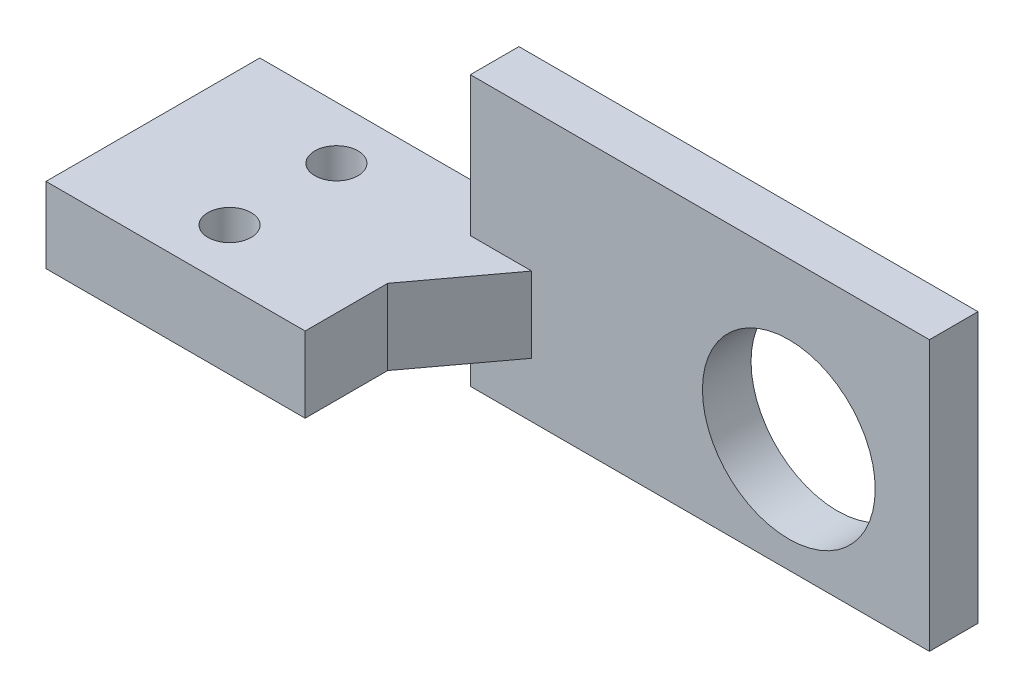
from build123d import *

# Parameters (mm, degrees)
SKETCH1_R                 = 11
SKETCH1_R_2               = 8
BOSS_EXTRUDE1_DEPTH       = 4.8
SKETCH2_W                 = 44.821432693
SKETCH2_H                 = 40.097165435
SKETCH2_R                 = 11
BOSS_EXTRUDE2_DEPTH       = 8.2
SKETCH3_W                 = 24
SKETCH3_H                 = 15
SKETCH3_R                 = 8
BOSS_EXTRUDE3_DEPTH       = 5
BOSS_EXTRUDE4_OUTLINE_W   = 48.178567307
BOSS_EXTRUDE4_OUTLINE_H   = 40.5
BOSS_EXTRUDE4_OUTLINE_R   = 1.6
BOSS_EXTRUDE4_OUTLINE_R_2 = 6.35
BOSS_EXTRUDE4_OUTLINE_R_3 = 2.1
BOSS_EXTRUDE4_DEPTH       = 5
BOSS_EXTRUDE5_DEPTH       = 5
SKETCH6_W                 = 48.178567307
SKETCH6_H                 = 17.568704936
BOSS_EXTRUDE6_DEPTH       = 5
SKETCH8_R                 = 2
CUT_EXTRUDE1_DEPTH        = 127.437257167
CUT_EXTRUDE2_START        = -23.95
CUT_EXTRUDE2_OUTLINE_W    = 64.98154514
CUT_EXTRUDE2_OUTLINE_H    = 102.7
CUT_EXTRUDE2_OUTLINE_R    = 11
CUT_EXTRUDE2_DEPTH        = 23.95
CUT_EXTRUDE2_START_2      = -45.3
CUT_EXTRUDE2_2_DEPTH      = 21.35
SKETCH13_W                = 48.029963693
SKETCH13_H                = 72.7
CUT_EXTRUDE5_DEPTH        = 100
SKETCH14_W                = 52.01845486
SKETCH14_H                = 5
CUT_EXTRUDE6_DEPTH        = 100
SKETCH15_W                = 24
SKETCH15_H                = 10
BOSS_EXTRUDE7_DEPTH       = 10
SKETCH16_R                = 2
CUT_EXTRUDE7_DEPTH        = 30
SKETCH17_W                = 28.01845486
SKETCH17_H                = 5.3
CUT_EXTRUDE11_DEPTH       = 100
SKETCH18_W                = 24
SKETCH18_H                = 4.59
CUT_EXTRUDE12_DEPTH       = 43.450839953
SKETCH19_W                = 4.5
SKETCH19_H                = 7
BOSS_EXTRUDE8_DEPTH       = 24
SKETCH20_W                = 24
SKETCH20_H                = 7
BOSS_EXTRUDE9_DEPTH       = 15.3
SKETCH21_R                = 2
CUT_EXTRUDE13_DEPTH       = 39
SKETCH22_W                = 24
SKETCH22_H                = 5.41
CUT_EXTRUDE14_DEPTH       = 39
BOSS_EXTRUDE11_START      = -7
BOSS_EXTRUDE11_DEPTH      = 7
SKETCH26_W                = 4.5
SKETCH26_H                = 25
BOSS_EXTRUDE12_DEPTH      = 14.5
BOSS_EXTRUDE13_START      = -4.5
SKETCH27_R                = 8
BOSS_EXTRUDE13_DEPTH      = 4.5
SKETCH28_R                = 8
CUT_EXTRUDE15_DEPTH       = 4.5


# Read off the part's stored shape, not the designer's step: Boss-Extrude4, Cut-Extrude2
with BuildPart() as part:
    # Sketch1 → Boss-Extrude1 (new body)
    # profile 1 of 2: a face of its own
    with BuildSketch(Plane.XY):
        Polygon((0, 0), (93, 0), (93, 102.7), (0, 102.7), (0, 30), (-24, 30), (-24, 15), (0, 15), align=None)
        with Locations((15, 10.5)):
            Circle(SKETCH1_R, mode=Mode.SUBTRACT)
        with Locations((70, 72)):
            Circle(SKETCH1_R, mode=Mode.SUBTRACT)
    # profile 2 of 2: a face of its own
    with BuildSketch(Plane.XY):
        with BuildLine():
            ThreePointArc((26, 10.5), (8.48332569, 19.36188219), (11.721280738, 0))
            Line((11.721280738, 0), (18.278719262, 0))
            ThreePointArc((18.278719262, 0), (23.86188219, 3.98332569), (26, 10.5))
        make_face()
        with Locations((15, 10.5)):
            Circle(SKETCH1_R_2, mode=Mode.SUBTRACT)
    extrude(amount=BOSS_EXTRUDE1_DEPTH)

    # Sketch2 → Boss-Extrude2 (add)
    with BuildSketch(Plane.XY.offset(4.8)):
        with Locations((70.589283654, 72.714594712)):
            Rectangle(SKETCH2_W, SKETCH2_H)
        with Locations((70, 72)):
            Circle(SKETCH2_R, mode=Mode.SUBTRACT)
    extrude(amount=BOSS_EXTRUDE2_DEPTH)

    # Sketch3 → Boss-Extrude3 (add)
    # profile 1 of 2: a face of its own
    with BuildSketch(Plane.XY.offset(4.8)):
        with Locations((-12, 22.5)):
            Rectangle(SKETCH3_W, SKETCH3_H)
    # profile 2 of 2: a face of its own
    with BuildSketch(Plane.XY.offset(4.8)):
        Polygon((0, 30), (0, 15), (0, 0), (93, 0), (93, 52.666011994), (48.178567307, 52.666011994), (0, 52.666011994), align=None)
        with Locations((15, 10.5)):
            Circle(SKETCH3_R, mode=Mode.SUBTRACT)
    extrude(amount=BOSS_EXTRUDE3_DEPTH)

    # Boss-Extrude4 outline → Boss-Extrude4 (add)
    # profile 1 of 2: a face of its own
    with BuildSketch(Plane.XZ.offset(-75.23471693)):
        with Locations((24.089283654, 25.05)):
            Rectangle(BOSS_EXTRUDE4_OUTLINE_W, BOSS_EXTRUDE4_OUTLINE_H)
        with Locations((22.860422048, 23.3)):
            Circle(BOSS_EXTRUDE4_OUTLINE_R, mode=Mode.SUBTRACT)
        with Locations((38.360422048, 30.3)):
            Circle(BOSS_EXTRUDE4_OUTLINE_R_2, mode=Mode.SUBTRACT)
        with Locations((30.610422048, 36.723393759)):
            Circle(BOSS_EXTRUDE4_OUTLINE_R, mode=Mode.SUBTRACT)
        with Locations((46.110422048, 36.723393759)):
            Circle(BOSS_EXTRUDE4_OUTLINE_R, mode=Mode.SUBTRACT)
    # profile 2 of 2: a face of its own
    with BuildSketch(Plane.XZ.offset(-75.23471693)):
        with Locations((51.783815806, 31.05)):
            Circle(BOSS_EXTRUDE4_OUTLINE_R_3)
    extrude(amount=BOSS_EXTRUDE4_DEPTH)

    # Sketch5 → Boss-Extrude5 (add)
    with BuildSketch(Plane(origin=(48.178567307, 0, 0), x_dir=(0, 0, -1), z_dir=(1, 0, 0))):
        Polygon((-45.3, 75.23471693), (-13, 92.763177429), (-4.8, 92.763177429), (-4.8, 70.23471693), (-45.3, 70.23471693), align=None)
    extrude(amount=-BOSS_EXTRUDE5_DEPTH)

    # Sketch6 → Boss-Extrude6 (add)
    with BuildSketch(Plane.XY.offset(4.8)):
        with Locations((24.089283654, 61.450364462)):
            Rectangle(SKETCH6_W, SKETCH6_H)
    extrude(amount=BOSS_EXTRUDE6_DEPTH)

    # Sketch8 → Cut-Extrude1 (cut, through all)
    with BuildSketch(Plane(origin=(0, 30, 0), x_dir=(1, 0, 0), z_dir=(0, 1, 0))):
        with Locations(Location((-12, -4.9, 0), (0, 0, 180))):
            Circle(SKETCH8_R)
    extrude(amount=-CUT_EXTRUDE1_DEPTH, mode=Mode.SUBTRACT)

    # Cut-Extrude2 outline → Cut-Extrude2 (cut)
    with BuildSketch(Plane(origin=(0, 0, 0), x_dir=(-1, 0, 0), z_dir=(0, 0, -1)).offset(CUT_EXTRUDE2_START)):
        with Locations((-60.50922743, 51.35)):
            Rectangle(CUT_EXTRUDE2_OUTLINE_W, CUT_EXTRUDE2_OUTLINE_H)
        with Locations((-70, 72)):
            Circle(CUT_EXTRUDE2_OUTLINE_R, mode=Mode.SUBTRACT)
    extrude(amount=CUT_EXTRUDE2_DEPTH, mode=Mode.SUBTRACT)

    # Cut-Extrude2 2 outline → Cut-Extrude2 2 (cut)
    with BuildSketch(Plane(origin=(0, 0, 0), x_dir=(-1, 0, 0), z_dir=(0, 0, -1)).offset(CUT_EXTRUDE2_START_2)):
        Polygon((-28.01845486, 70.23471693), (-28.01845486, 75.23471693), (-43.178567307, 75.23471693), (-43.178567307, 92.763177429), (-48.178567307, 92.763177429), (-48.178567307, 70.23471693), align=None)
    extrude(amount=CUT_EXTRUDE2_2_DEPTH, mode=Mode.SUBTRACT)

    # Sketch13 → Cut-Extrude5 (cut)
    with BuildSketch(Plane.ZY):
        with Locations((24.014981847, 66.35)):
            Rectangle(SKETCH13_W, SKETCH13_H)
    extrude(amount=-CUT_EXTRUDE5_DEPTH, mode=Mode.SUBTRACT)

    # Sketch14 → Cut-Extrude6 (cut)
    with BuildSketch(Plane.XY.offset(9.8)):
        with Locations((2.00922743, 27.5)):
            Rectangle(SKETCH14_W, SKETCH14_H)
    extrude(amount=-CUT_EXTRUDE6_DEPTH, mode=Mode.SUBTRACT)

    # Sketch15 → Boss-Extrude7 (add)
    with BuildSketch(Plane.XY.offset(9.8)):
        with Locations((-12, 20)):
            Rectangle(SKETCH15_W, SKETCH15_H)
    extrude(amount=BOSS_EXTRUDE7_DEPTH)

    # Sketch16 → Cut-Extrude7 (cut)
    with BuildSketch(Plane(origin=(0, 25, 0), x_dir=(1, 0, 0), z_dir=(0, 1, 0))):
        with Locations(Location((-12, -14.8, 0), (0, 0, 270))):
            Circle(SKETCH16_R)
    extrude(amount=-CUT_EXTRUDE7_DEPTH, mode=Mode.SUBTRACT)

    # Sketch17 → Cut-Extrude11 (cut)
    with BuildSketch(Plane(origin=(0, 25, 0), x_dir=(1, 0, 0), z_dir=(0, 1, 0))):
        with Locations((14.00922743, -7.15)):
            Rectangle(SKETCH17_W, SKETCH17_H)
    extrude(amount=-CUT_EXTRUDE11_DEPTH, mode=Mode.SUBTRACT)

    # Sketch18 → Cut-Extrude12 (cut, through all)
    with BuildSketch(Plane(origin=(0, 0, 0), x_dir=(-1, 0, 0), z_dir=(0, 0, -1))):
        with Locations((12, 17.295)):
            Rectangle(SKETCH18_W, SKETCH18_H)
    extrude(amount=-CUT_EXTRUDE12_DEPTH, mode=Mode.SUBTRACT)

    # Sketch19 → Boss-Extrude8 (add)
    with BuildSketch(Plane.ZY):
        with Locations((2.25, 8.59)):
            Rectangle(SKETCH19_W, SKETCH19_H)
    extrude(amount=BOSS_EXTRUDE8_DEPTH)

    # Sketch20 → Boss-Extrude9 (add)
    with BuildSketch(Plane.XY.offset(4.5)):
        with Locations((-12, 8.59)):
            Rectangle(SKETCH20_W, SKETCH20_H)
    extrude(amount=BOSS_EXTRUDE9_DEPTH)

    # Sketch21 → Cut-Extrude13 (cut)
    with BuildSketch(Plane(origin=(0, 25, 0), x_dir=(1, 0, 0), z_dir=(0, 1, 0))):
        with Locations(Location((-12, -4.9, 0), (0, 0, 180))):
            Circle(SKETCH21_R)
        with Locations(Location((-12, -14.8, 0), (0, 0, 270))):
            Circle(SKETCH21_R)
    extrude(amount=-CUT_EXTRUDE13_DEPTH, mode=Mode.SUBTRACT)

    # Sketch22 → Cut-Extrude14 (cut)
    with BuildSketch(Plane(origin=(0, 0, 0), x_dir=(-1, 0, 0), z_dir=(0, 0, -1))):
        with Locations((12, 22.295)):
            Rectangle(SKETCH22_W, SKETCH22_H)
    extrude(amount=-CUT_EXTRUDE14_DEPTH, mode=Mode.SUBTRACT)

    # Sketch25 → Boss-Extrude11 (add)
    with BuildSketch(Plane.XZ.offset(-5.09).offset(BOSS_EXTRUDE11_START)):
        Polygon((0, 4.5), (0, 12.15), (5.681243584, 4.5), align=None)
    extrude(amount=BOSS_EXTRUDE11_DEPTH)

    # Sketch26 → Boss-Extrude12 (add)
    with BuildSketch(Plane(origin=(28.01845486, 0, 0), x_dir=(0, 0, -1), z_dir=(1, 0, 0))):
        with Locations((-2.25, 12.5)):
            Rectangle(SKETCH26_W, SKETCH26_H)
    extrude(amount=BOSS_EXTRUDE12_DEPTH)

    # Sketch27 → Boss-Extrude13 (add)
    with BuildSketch(Plane.XY.offset(4.5).offset(BOSS_EXTRUDE13_START)):
        with Locations((15, 10.5)):
            Circle(SKETCH27_R)
    extrude(amount=BOSS_EXTRUDE13_DEPTH)

    # Sketch28 → Cut-Extrude15 (cut)
    with BuildSketch(Plane.XY.offset(4.5)):
        with Locations((29.49845486, 10.5)):
            Circle(SKETCH28_R)
    extrude(amount=-CUT_EXTRUDE15_DEPTH, mode=Mode.SUBTRACT)


solid = part.part
